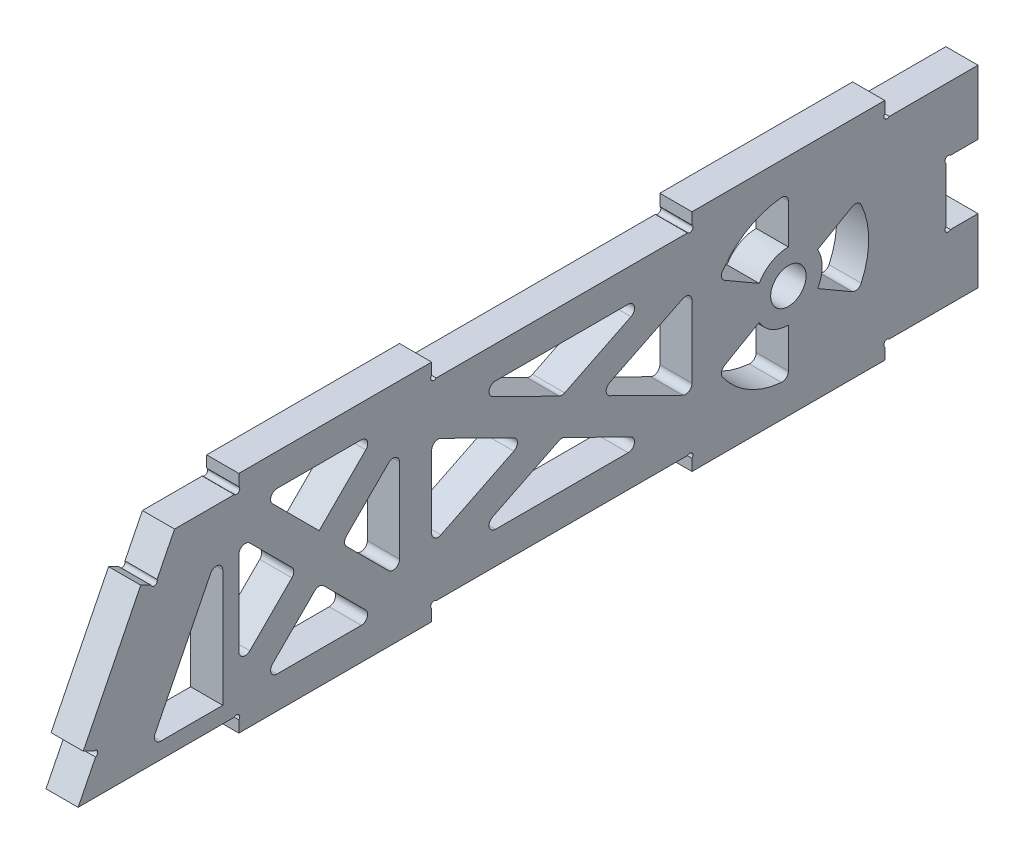
from build123d import *

# Parameters (mm, degrees)
SKETCH1_W               = 355.6
SKETCH1_H               = 76.2
BOSS_EXTRUDE1_DEPTH     = 12.7
CUT_EXTRUDE1_DEPTH      = 183.279291199
CUT_EXTRUDE1_DEPTH_BACK = 183.279291199
SKETCH3_W               = 76.2
SKETCH3_H               = 6.35
BOSS_EXTRUDE2_DEPTH     = 12.7
SKETCH4_W               = 12.7
SKETCH4_H               = 25.4
CUT_EXTRUDE2_DEPTH      = 184.711546997
SKETCH5_R               = 7
CUT_EXTRUDE3_DEPTH      = 184.711546997
CUT_EXTRUDE4_DEPTH      = 184.711546997
BOSS_EXTRUDE3_DEPTH     = 12.7
SKETCH9_R               = 1.27
CUT_EXTRUDE6_DEPTH      = 184.711546997
CUT_EXTRUDE7_DEPTH      = 184.711546997
FILLET1_R               = 2.54
FILLET2_R               = 2.54


with BuildPart() as part:
    # Sketch1 → Boss-Extrude1 (new body)
    with BuildSketch(Plane(origin=(0, 0, 0), x_dir=(0, 0, -1), z_dir=(1, 0, 0))):
        Rectangle(SKETCH1_W, SKETCH1_H)
    extrude(amount=BOSS_EXTRUDE1_DEPTH)

    # Sketch2 → Cut-Extrude1 (cut, two sides: drawn at the far end of the back side and taken through both)
    with BuildSketch(Plane(origin=(12.7, 0, 0), x_dir=(0, 0, -1), z_dir=(1, 0, 0)).offset(-CUT_EXTRUDE1_DEPTH_BACK)):
        Polygon((-507.550847217, -697.601694433), (-177.8, -38.1), (-139.7, 38.1), (190.050847217, 697.601694433), (-1128.95254165, 1357.103388866), (-1826.554236083, -38.1), align=None)
    extrude(amount=CUT_EXTRUDE1_DEPTH + CUT_EXTRUDE1_DEPTH_BACK, mode=Mode.SUBTRACT)

    # Sketch3 → Boss-Extrude2 (add)
    with BuildSketch(Plane.ZY):
        with Locations((-102.87, -41.275)):
            Rectangle(SKETCH3_W, SKETCH3_H)
        with Locations((76.2, -41.275)):
            Rectangle(SKETCH3_W, SKETCH3_H)
        with Locations((-102.87, 41.275)):
            Rectangle(SKETCH3_W, SKETCH3_H)
        with Locations((76.2, 41.275)):
            Rectangle(SKETCH3_W, SKETCH3_H)
    extrude(amount=-BOSS_EXTRUDE2_DEPTH)

    # Sketch4 → Cut-Extrude2 (cut, through all)
    with BuildSketch(Plane.ZY):
        with Locations((-171.45, 0)):
            Rectangle(SKETCH4_W, SKETCH4_H)
    extrude(amount=-CUT_EXTRUDE2_DEPTH, mode=Mode.SUBTRACT)

    # Sketch5 → Cut-Extrude3 (cut, through all)
    with BuildSketch(Plane.ZY):
        with Locations((-102.87, 0)):
            Circle(SKETCH5_R)
    extrude(amount=-CUT_EXTRUDE3_DEPTH, mode=Mode.SUBTRACT)

    # Sketch6 → Cut-Extrude4 (cut, through all)
    with BuildSketch(Plane.ZY):
        Polygon((23.758802297, 25.4), (-50.428802297, 25.4), (-13.335, 7.08207294), align=None)
        Polygon((-27.676197703, 0), (-64.77, 18.31792706), (-64.77, -18.31792706), align=None)
        Polygon((38.1, -18.31792706), (38.1, 18.31792706), (1.006197703, 0), align=None)
        Polygon((-13.335, -7.08207294), (-50.428802297, -25.4), (23.758802297, -25.4), align=None)
        Polygon((105.319743879, 31.75), (59.780256121, 31.75), (82.55, 8.980256121), align=None)
        Polygon((73.569743879, 0), (50.8, 22.769743879), (50.8, -22.769743879), align=None)
        Polygon((114.3, 22.769743879), (91.530256121, 0), (114.3, -22.769743879), align=None)
        Polygon((105.319743879, -31.75), (82.55, -8.980256121), (59.780256121, -31.75), align=None)
    extrude(amount=-CUT_EXTRUDE4_DEPTH, mode=Mode.SUBTRACT)

    # Sketch8 → Boss-Extrude3 (add)
    with BuildSketch(Plane(origin=(12.7, 0, 0), x_dir=(0, 0, -1), z_dir=(1, 0, 0))):
        Polygon((-147.390774674, 22.718450651), (-170.109225326, -22.718450651), (-175.788837989, -19.87864432), (-153.070387337, 25.558256983), align=None)
    extrude(amount=-BOSS_EXTRUDE3_DEPTH)

    # Sketch9 → Cut-Extrude6 (cut, through all)
    with BuildSketch(Plane.ZY):
        with Locations((-165.998025612, 11.801974388)):
            Circle(SKETCH9_R)
        with Locations((-165.998025612, -11.801974388)):
            Circle(SKETCH9_R)
        with Locations((-141.868025612, 38.998025612)):
            Circle(SKETCH9_R)
        with Locations((-141.868025612, -38.998025612)):
            Circle(SKETCH9_R)
        with Locations((-63.871974388, -38.998025612)):
            Circle(SKETCH9_R)
        with Locations((-63.871974388, 38.998025612)):
            Circle(SKETCH9_R)
        with Locations((37.201974388, 38.998025612)):
            Circle(SKETCH9_R)
        with Locations((37.201974388, -38.998025612)):
            Circle(SKETCH9_R)
        with Locations((115.198025612, -38.998025612)):
            Circle(SKETCH9_R)
        with Locations((115.198025612, 38.998025612)):
            Circle(SKETCH9_R)
        with Locations((147.792383937, 23.92327844)):
            Circle(SKETCH9_R)
        with Locations((171.314053114, -23.120059914)):
            Circle(SKETCH9_R)
    extrude(amount=-CUT_EXTRUDE6_DEPTH, mode=Mode.SUBTRACT)

    # Sketch10 → Cut-Extrude7 (cut, through all)
    with BuildSketch(Plane.ZY):
        with BuildLine():
            Line((-130.36630657, -15.875), (-114.431439141, -6.675))
            ThreePointArc((-114.431439141, -6.675), (-116.22, 0), (-114.431439141, 6.675))
            Line((-114.431439141, 6.675), (-130.36630657, 15.875))
            ThreePointArc((-130.36630657, 15.875), (-134.62, 0), (-130.36630657, -15.875))
        make_face()
        with BuildLine():
            ThreePointArc((-91.308560859, -6.675), (-96.195, -11.561439141), (-102.87, -13.35))
            Line((-102.87, -13.35), (-102.87, -31.75))
            ThreePointArc((-102.87, -31.75), (-86.995, -27.49630657), (-75.37369343, -15.875))
            Line((-75.37369343, -15.875), (-91.308560859, -6.675))
        make_face()
        with BuildLine():
            Line((-102.87, 31.75), (-102.87, 13.35))
            ThreePointArc((-102.87, 13.35), (-96.195, 11.561439141), (-91.308560859, 6.675))
            Line((-91.308560859, 6.675), (-75.37369343, 15.875))
            ThreePointArc((-75.37369343, 15.875), (-86.995, 27.49630657), (-102.87, 31.75))
        make_face()
        Polygon((120.65, 25.4), (120.65, -31.75), (149.225, -31.75), align=None)
    extrude(amount=-CUT_EXTRUDE7_DEPTH, mode=Mode.SUBTRACT)

    # Fillet1
    fillet1_edges = [part.edges().sort_by_distance(p)[0] for p in [
        (6.35, 15.875, -75.37369343),
        (6.35, 31.75, -102.87),
        (6.35, -31.75, -102.87),
        (6.35, -15.875, -75.37369343),
        (6.35, 15.875, -130.36630657),
        (6.35, -15.875, -130.36630657),
    ]]
    fillet(fillet1_edges, radius=FILLET1_R)

    # Fillet2
    fillet2_edges = [part.edges().sort_by_distance(p)[0] for p in [
        (6.35, 18.31792706, -64.77),
        (6.35, -18.31792706, -64.77),
        (6.35, -25.4, -50.428802297),
        (6.35, -25.4, 23.758802297),
        (6.35, 0, -27.676197703),
        (6.35, 0, 1.006197703),
        (6.35, -7.08207294, -13.335),
        (6.35, 18.31792706, 38.1),
        (6.35, -18.31792706, 38.1),
        (6.35, 7.08207294, -13.335),
        (6.35, 25.4, 23.758802297),
        (6.35, 25.4, -50.428802297),
        (6.35, -31.75, 149.225),
        (6.35, 25.4, 120.65),
        (6.35, -31.75, 59.780256121),
        (6.35, -31.75, 105.319743879),
        (6.35, 22.769743879, 50.8),
        (6.35, -22.769743879, 50.8),
        (6.35, -22.769743879, 114.3),
        (6.35, -8.980256121, 82.55),
        (6.35, 22.769743879, 114.3),
        (6.35, 0, 73.569743879),
        (6.35, 31.75, 105.319743879),
        (6.35, 0, 91.530256121),
        (6.35, 31.75, 59.780256121),
    ]]
    fillet(fillet2_edges, radius=FILLET2_R)


solid = part.part
